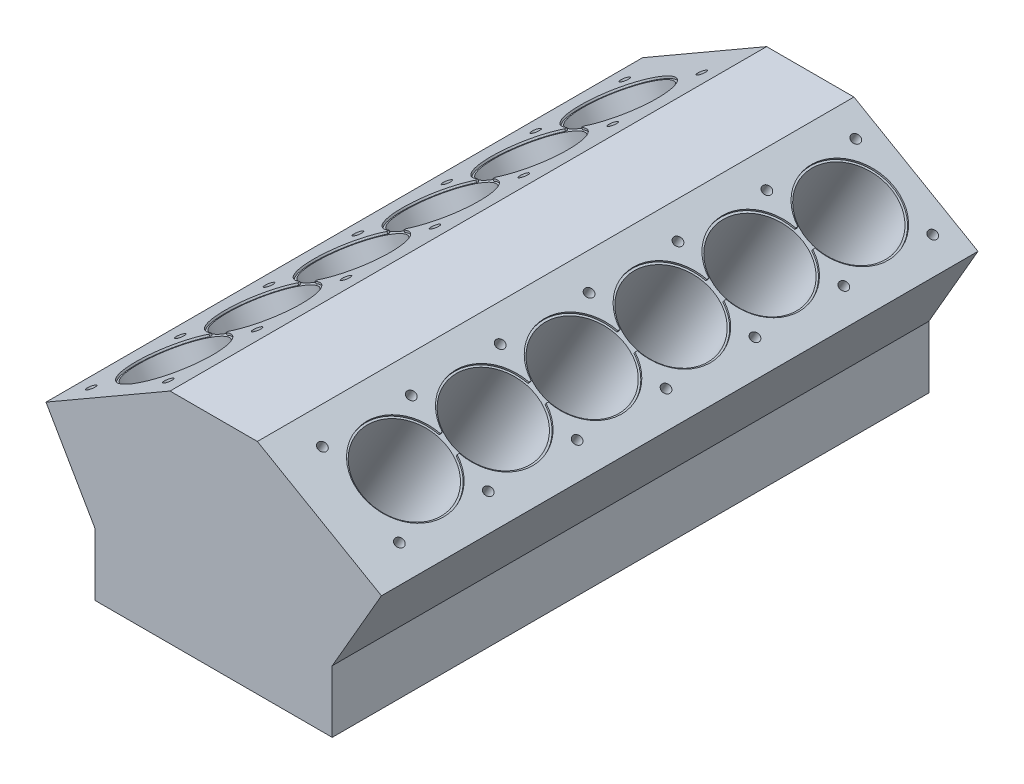
from build123d import *

# Parameters (mm, degrees)
BOSS_EXTRUDE1_DEPTH        = 302
SKETCH2_R                  = 43
CUT_EXTRUDE1_DEPTH         = 154
SKETCH3_R                  = 43
CUT_EXTRUDE2_DEPTH         = 154
LPATTERN1_COUNT            = 6
LPATTERN1_PITCH            = 90
CUT_EXTRUDE4_DEPTH         = 2
CUT_EXTRUDE5_DEPTH         = 2
M10X1_0_TAPPED_HOLE1_D     = 9
M10X1_0_TAPPED_HOLE1_DEPTH = 47
M10X1_0_TAPPED_HOLE1_TIP   = 2.703872786
LPATTERN2_COUNT            = 2
LPATTERN2_PITCH            = 90
LPATTERN2_COUNT_DIR2       = 7
LPATTERN2_PITCH_DIR2       = 90


with BuildPart() as part:
    # Sketch1 → Boss-Extrude1 (new, symmetric)
    with BuildSketch(Plane.XY):
        Polygon((0, 0), (120, 0), (120, 62.846096908), (169.786841774, 149.07943641), (44.213158226, 221.57943641), (0, 221.57943641), align=None)
    extrude(amount=BOSS_EXTRUDE1_DEPTH, both=True)

    # Mirror1: part across plane


with BuildPart() as part_1:
    add(part.part)
    add(part.part.mirror(Plane(origin=(0, 0, 0), x_dir=(0, 0, 1), z_dir=(1, 0, 0))))

    # Sketch2 → Cut-Extrude1 (cut)
    with BuildSketch(Plane(origin=(-107, 185.32943641, 0), x_dir=(-0.8660254037844382, -0.5000000000000009, 0), z_dir=(0.5000000000000009, -0.8660254037844383, 0))):
        with Locations((0, 215)):
            Circle(SKETCH2_R)
    cut_extrude1 = extrude(amount=CUT_EXTRUDE1_DEPTH, mode=Mode.SUBTRACT)

    # Sketch3 → Cut-Extrude2 (cut)
    with BuildSketch(Plane(origin=(107, 185.32943641, 0), x_dir=(0.8660254037844382, -0.5000000000000009, 0), z_dir=(0.5000000000000009, 0.8660254037844383, 0))):
        with Locations((0, 235)):
            Circle(SKETCH3_R)
    cut_extrude2 = extrude(amount=-CUT_EXTRUDE2_DEPTH, mode=Mode.SUBTRACT)

    # LPattern1: Cut-Extrude1, Cut-Extrude2 ×6
    with Locations(*[(0, 0, i * LPATTERN1_PITCH) for i in range(1, LPATTERN1_COUNT)]):
        add(cut_extrude1, mode=Mode.SUBTRACT)
        add(cut_extrude2, mode=Mode.SUBTRACT)

    # Sketch4 → Cut-Extrude4 (cut)
    with BuildSketch(Plane(origin=(-107, 185.32943641, 0), x_dir=(0.8660254037844382, 0.5000000000000009, 0), z_dir=(-0.5000000000000009, 0.8660254037844383, 0))):
        with BuildLine():
            Line((-10, 171.125178063), (-10, 168.919134034))
            ThreePointArc((-10, 168.919134034), (-45.229891353, 124.992547813), (-10, 81.065961592))
            Line((-10, 81.065961592), (-10, 78.90454927))
            ThreePointArc((-10, 78.90454927), (-45.164441141, 34.992571611), (-10, -8.919406048))
            Line((-10, -8.919406048), (-10, -11.11013794))
            ThreePointArc((-10, -11.11013794), (-45.09899093, -55.00740459), (-10, -98.904671241))
            Line((-10, -98.904671241), (-10, -101.146617341))
            ThreePointArc((-10, -101.146617341), (-44.938517527, -145.007380792), (-10, -188.868144242))
            Line((-10, -188.868144242), (-10, -191.139831299))
            ThreePointArc((-10, -191.139831299), (0, -279.985713271), (10, -191.139831299))
            Line((10, -191.139831299), (10, -188.896170583))
            ThreePointArc((10, -188.896170583), (45.061482473, -145.007380792), (10, -101.118591))
            Line((10, -101.118591), (10, -98.859546866))
            ThreePointArc((10, -98.859546866), (44.90100907, -55.00740459), (10, -11.155262314))
            Line((10, -11.155262314), (10, -8.844446265))
            ThreePointArc((10, -8.844446265), (44.835558859, 34.992571611), (10, 78.829589488))
            Line((10, 78.829589488), (10, 81.17075731))
            ThreePointArc((10, 81.17075731), (44.770108647, 124.992547813), (10, 168.814338316))
            Line((10, 168.814338316), (10, 171.125178063))
            ThreePointArc((10, 171.125178063), (0, 260), (-10, 171.125178063))
        make_face()
    extrude(amount=-CUT_EXTRUDE4_DEPTH, mode=Mode.SUBTRACT)

    # Sketch6 → Cut-Extrude5 (cut)
    with BuildSketch(Plane(origin=(107, 185.32943641, 0), x_dir=(0.8660254037844382, -0.5000000000000009, 0), z_dir=(0.5000000000000009, 0.8660254037844383, 0))):
        with BuildLine():
            Line((-10, 191.125178063), (-10, 188.919134034))
            ThreePointArc((-10, 188.919134034), (-45.229891353, 144.992547813), (-10, 101.065961592))
            Line((-10, 101.065961592), (-10, 98.90454927))
            ThreePointArc((-10, 98.90454927), (-45.164441141, 54.992571611), (-10, 11.080593952))
            Line((-10, 11.080593952), (-10, 8.88986206))
            ThreePointArc((-10, 8.88986206), (-45.09899093, -35.00740459), (-10, -78.904671241))
            Line((-10, -78.904671241), (-10, -81.146617341))
            ThreePointArc((-10, -81.146617341), (-44.938517527, -125.007380792), (-10, -168.868144242))
            Line((-10, -168.868144242), (-10, -171.139831299))
            ThreePointArc((-10, -171.139831299), (0, -259.985713271), (10, -171.139831299))
            Line((10, -171.139831299), (10, -168.896170583))
            ThreePointArc((10, -168.896170583), (45.061482473, -125.007380792), (10, -81.118591))
            Line((10, -81.118591), (10, -78.859546866))
            ThreePointArc((10, -78.859546866), (44.90100907, -35.00740459), (10, 8.844737686))
            Line((10, 8.844737686), (10, 11.155553735))
            ThreePointArc((10, 11.155553735), (44.835558859, 54.992571611), (10, 98.829589488))
            Line((10, 98.829589488), (10, 101.17075731))
            ThreePointArc((10, 101.17075731), (44.770108647, 144.992547813), (10, 188.814338316))
            Line((10, 188.814338316), (10, 191.125178063))
            ThreePointArc((10, 191.125178063), (0, 280), (-10, 191.125178063))
        make_face()
    extrude(amount=-CUT_EXTRUDE5_DEPTH, mode=Mode.SUBTRACT)

    # M10x1.0 Tapped Hole1
    with Locations(Plane(origin=(-107, 185.32943641, 0), x_dir=(0.8660254037844382, 0.5000000000000009, 0), z_dir=(-0.5000000000000009, 0.8660254037844383, 0))):
        with Locations((45, 260), (-45, 260), (45, 170), (-45, 170), (45, 80), (-45, 80), (45, -10), (-45, -10), (45, -100), (-45, -100), (45, -190), (-45, -190), (45, -280), (-45, -280)):
            Hole(M10X1_0_TAPPED_HOLE1_D / 2, depth=M10X1_0_TAPPED_HOLE1_DEPTH)
            with Locations((0, 0, -(M10X1_0_TAPPED_HOLE1_DEPTH + M10X1_0_TAPPED_HOLE1_TIP / 2))):  # 118° drill point
                Cone(0, M10X1_0_TAPPED_HOLE1_D / 2, M10X1_0_TAPPED_HOLE1_TIP, mode=Mode.SUBTRACT)

    # Sketch11 → M10x1.0 Tapped Hole2 (revolve, cut)
    with BuildSketch(Plane(origin=(68.02885683, 207.82943641, -280), x_dir=(-0.8660254037844383, 0.5000000000000009, 0), z_dir=(0, 0, 1))):
        Polygon((0, 0), (0, 49.703872786), (4.5, 47), (4.5, 0), align=None)
    m10x1_0_tapped_hole2 = revolve(axis=Axis((71.20385683, 213.328697724, -280), (-0.5000000000000008, -0.8660254037844382, 0)), mode=Mode.SUBTRACT)

    # LPattern2: M10x1.0 Tapped Hole2 2 × 7
    with Locations(*[Vector(0.8660254037844382, -0.5000000000000009, 0) * (i * LPATTERN2_PITCH) + Vector(0, 0, 1) * (j * LPATTERN2_PITCH_DIR2) for i in range(LPATTERN2_COUNT) for j in range(LPATTERN2_COUNT_DIR2) if (i, j) != (0, 0)]):
        add(m10x1_0_tapped_hole2, mode=Mode.SUBTRACT)


solid = part_1.part
